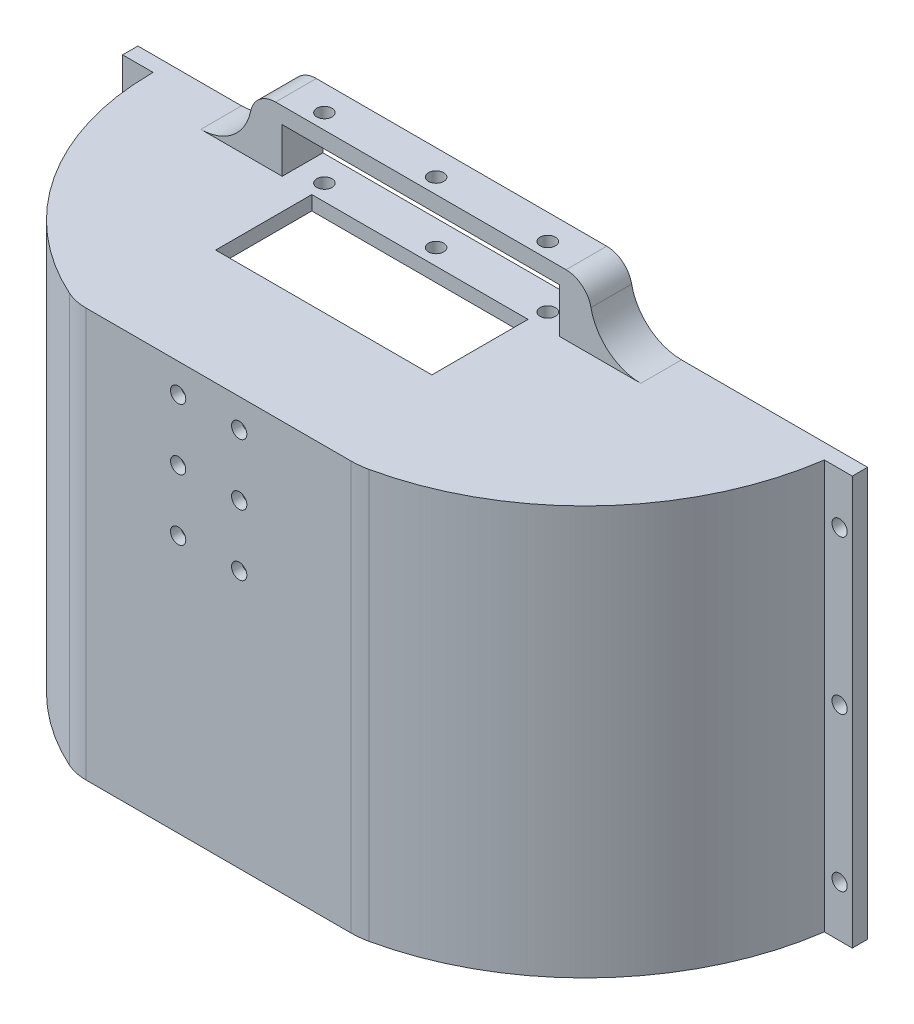
from build123d import *

# Parameters (mm, degrees)
SKETCH_1_W                  = 143.42529591
SKETCH_1_H                  = 80.35
SKETCH_1_R                  = 1.5
SKETCH_1_W_2                = 127.420983087
SKETCH_1_H_2                = 74.55
EXTRUDE_1_DEPTH             = 3
SKETCH_2_W                  = 131.42529591
SKETCH_2_H                  = 5
SKETCH_2_R                  = 1.5
EXTRUDE_2_DEPTH             = 2.8
SKETCH_3_R                  = 1.5
CUT_EXTRUDE_1_DEPTH         = 10
SKETCH_4_W                  = 6
SKETCH_4_H                  = 8
EXTRUDE_3_DEPTH             = 10
SKETCH_5_W                  = 54.485918212
SKETCH_5_H                  = 8
EXTRUDE_4_DEPTH             = 1.2
FILLET_1_R                  = 10
SKETCH_6_R                  = 1.5
CUT_EXTRUDE_2_DEPTH         = 3
EXTRUDE_5_DEPTH             = 2.8
SKETCH_8_W                  = 42.5
SKETCH_8_H                  = 8
SKETCH_8_H_2                = 10.9
SKETCH_8_R                  = 1.5
CUT_EXTRUDE_3_DEPTH         = 3
EXTRUDE_6_REACH             = 127.55
EXTRUDE_6_DIRECTION_2_DEPTH = 2.8
SKETCH_11_R                 = 1.5
SKETCH_11_R_2               = 1.490339558
CUT_EXTRUDE_4_DEPTH         = 3
EXTRUDE_START               = -3
EXTRUDE_7_DEPTH             = 3
EXTRUDE_START_2             = 2
SKETCH_13_W                 = 66.485918212
SKETCH_13_H                 = 8
SKETCH_13_R                 = 1.5
EXTRUDE_8_DEPTH             = 2
FILLET_2_R                  = 5


with BuildPart() as part:
    # 草图1 → 凸台-拉伸1 (new body)
    with BuildSketch(Plane.XY):
        with Locations((-13.602517363, 6.11984421)):
            Rectangle(SKETCH_1_W, SKETCH_1_H)
        with Locations((55.610130592, -24.05515579)):
            Circle(SKETCH_1_R, mode=Mode.SUBTRACT)
        with Locations((55.610130592, 6.11984421)):
            Circle(SKETCH_1_R, mode=Mode.SUBTRACT)
        with Locations((55.610130592, 36.29484421)):
            Circle(SKETCH_1_R, mode=Mode.SUBTRACT)
        with Locations((-82.810852495, -24.05515579)):
            Circle(SKETCH_1_R, mode=Mode.SUBTRACT)
        with Locations((-82.810852495, 6.11984421)):
            Circle(SKETCH_1_R, mode=Mode.SUBTRACT)
        with Locations((-82.810852495, 36.29484421)):
            Circle(SKETCH_1_R, mode=Mode.SUBTRACT)
        with Locations((-13.600360952, 6.21984421)):
            Rectangle(SKETCH_1_W_2, SKETCH_1_H_2, mode=Mode.SUBTRACT)
    extrude(amount=EXTRUDE_1_DEPTH)

    # 草图2 → 凸台-拉伸2 (add)
    with BuildSketch(Plane(origin=(0, 46.29484421, 0), x_dir=(1, 0, 0), z_dir=(0, 1, 0))):
        with Locations((-13.602517363, -5.5)):
            Rectangle(SKETCH_2_W, SKETCH_2_H)
        with Locations(Location((-21.702517363, -5, 0), (0, 0, 180))):
            Circle(SKETCH_2_R, mode=Mode.SUBTRACT)
    extrude(amount=-EXTRUDE_2_DEPTH)

    # 草图3 → 切除-拉伸1 (cut)
    with BuildSketch(Plane(origin=(0, 46.29484421, 0), x_dir=(1, 0, 0), z_dir=(0, 1, 0))):
        with Locations(Location((0.240439338, -5, 0), (0, 0, 270))):
            Circle(SKETCH_3_R)
        with Locations(Location((-43.645478874, -5, 0), (0, 0, 270))):
            Circle(SKETCH_3_R)
    extrude(amount=-CUT_EXTRUDE_1_DEPTH, mode=Mode.SUBTRACT)

    # 草图4 → 凸台-拉伸3 (add)
    with BuildSketch(Plane(origin=(0, 46.29484421, 0), x_dir=(1, 0, 0), z_dir=(0, 1, 0))):
        with Locations((8.540439338, -4)):
            Rectangle(SKETCH_4_W, SKETCH_4_H)
        with Locations((-51.945478874, -4)):
            Rectangle(SKETCH_4_W, SKETCH_4_H)
    extrude(amount=EXTRUDE_3_DEPTH)

    # 草图5 → 凸台-拉伸4 (add)
    with BuildSketch(Plane(origin=(0, 56.29484421, 0), x_dir=(1, 0, 0), z_dir=(0, 1, 0))):
        with Locations((-21.702519768, -4)):
            Rectangle(SKETCH_5_W, SKETCH_5_H)
    extrude(amount=-EXTRUDE_4_DEPTH)

    # 圆角1
    fillet_1_edges = [part.edges().sort_by_distance(p)[0] for p in [
        (11.540439338, 46.29484421, 4),
        (-54.945478874, 46.29484421, 4),
    ]]
    fillet(fillet_1_edges, radius=FILLET_1_R - 0.0001)  # a hair under: the kernel refuses the full size

    # 草图6 → 切除-拉伸2 (cut)
    with BuildSketch(Plane(origin=(0, 56.29484421, 0), x_dir=(1, 0, 0), z_dir=(0, 1, 0))):
        with Locations(Location((0.240439338, -5, 0), (0, 0, 270))):
            Circle(SKETCH_6_R)
        with Locations(Location((-21.702517363, -5, 0), (0, 0, 180))):
            Circle(SKETCH_6_R)
        with Locations(Location((-43.645478874, -5, 0), (0, 0, 270))):
            Circle(SKETCH_6_R)
    extrude(amount=-CUT_EXTRUDE_2_DEPTH, mode=Mode.SUBTRACT)

    # 草图7 → 凸台-拉伸5 (add)
    with BuildSketch(Plane(origin=(0, 46.29484421, 0), x_dir=(1, 0, 0), z_dir=(0, 1, 0))):
        with BuildLine():
            Line((52.110130592, -3), (-79.315165318, -3))
            ThreePointArc((-79.315165318, -3), (-71.408587337, -30.249323597), (-49.947485102, -48.808976146))
            ThreePointArc((-49.947485102, -48.808976146), (-47.931875984, -49.474706171), (-45.821160639, -49.7))
            Line((-45.821160639, -49.7), (3.801028521, -49.7))
            ThreePointArc((3.801028521, -49.7), (4.482979053, -49.676720076), (5.161754433, -49.606988694))
            ThreePointArc((5.161754433, -49.606988694), (36.42646247, -34.151078405), (52.110130592, -3))
        make_face()
    extrude(amount=-EXTRUDE_5_DEPTH)

    # 草图8 → 切除-拉伸3 (cut)
    with BuildSketch(Plane(origin=(0, 46.29484421, 0), x_dir=(1, 0, 0), z_dir=(0, 1, 0))):
        with BuildLine():
            Line((52.110130592, -8), (52.110130592, -3))
            ThreePointArc((52.110130592, -3), (51.686965751, -5.511139637), (51.148017839, -8))
            Line((51.148017839, -8), (52.110130592, -8))
        make_face()
        with BuildLine():
            ThreePointArc((-79.091069545, -8), (-79.253197971, -5.766605102), (-79.315165318, -3.528190833))
            Line((-79.315165318, -3.528190833), (-79.315165318, -8))
            Line((-79.315165318, -8), (-79.091069545, -8))
        make_face()
        with BuildLine():
            Line((-79.315165318, -3.528190833), (-79.315165318, -3))
            ThreePointArc((-79.315165318, -3), (-79.315862787, -3.264095416), (-79.315165318, -3.528190833))
        make_face()
        with Locations((-21.687503936, -23.091321672)):
            Rectangle(SKETCH_8_W, SKETCH_8_H)
        with Locations((-21.687503936, -13.641321672)):
            Rectangle(SKETCH_8_W, SKETCH_8_H_2)
        with Locations(Location((0.240439338, -5, 0), (0, 0, 270))):
            Circle(SKETCH_8_R)
        with Locations(Location((-43.645478874, -5, 0), (0, 0, 270))):
            Circle(SKETCH_8_R)
        with Locations(Location((-21.702517363, -5, 0), (0, 0, 270))):
            Circle(SKETCH_8_R)
    extrude(amount=-CUT_EXTRUDE_3_DEPTH, mode=Mode.SUBTRACT)

    # 凸台-拉伸6: up to this face of the body (flat: up to its plane)
    extrude_6_end = Plane(part.part.faces().sort_by_distance((-13.602517363, -34.05515579, 1.5))[0])
    # 草图9 → 凸台-拉伸6 (add, up to the picked face)
    with BuildSketch(Plane.XZ.offset(-43.49484421), mode=Mode.PRIVATE) as extrude_6_sk1:
        with BuildLine():
            ThreePointArc((-45.821160639, 49.7), (-47.931875984, 49.474706171), (-49.947485102, 48.808976146))
            ThreePointArc((-49.947485102, 48.808976146), (-71.265466668, 30.471277082), (-79.315165318, 3.528190833))
            Line((-79.315165318, 3.528190833), (-79.315165318, 3))
            Line((-79.315165318, 3), (-77.284463301, 3))
            Line((-77.284463301, 3), (-77.284463301, 5))
            ThreePointArc((-77.284463301, 5), (-69.179280492, 30.001857642), (-49.122220209, 46.987180917))
            ThreePointArc((-49.122220209, 46.987180917), (-47.509732915, 47.519764937), (-45.821160639, 47.7))
            Line((-45.821160639, 47.7), (3.801028521, 47.7))
            ThreePointArc((3.801028521, 47.7), (4.346588947, 47.681376061), (4.889609251, 47.625590956))
            ThreePointArc((4.889609251, 47.625590956), (34.185844829, 33.539377025), (49.748453895, 5))
            Line((49.748453895, 5), (50.110130592, 3))
            Line((50.110130592, 3), (52.615296987, 3))
            ThreePointArc((52.615296987, 3), (38.28835989, 32.947499211), (9.430945753, 49.359795972))
            ThreePointArc((9.430945753, 49.359795972), (7.851760578, 49.614706494), (6.254409581, 49.7))
            Line((6.254409581, 49.7), (-45.821160639, 49.7))
        make_face()
    extrude_6_tool1 = split(extrude(extrude_6_sk1.sketch, amount=EXTRUDE_6_REACH, mode=Mode.PRIVATE), bisect_by=extrude_6_end, keep=Keep.BOTH, mode=Mode.PRIVATE)
    add(extrude_6_tool1.solids().sort_by(Axis((-47.636477, 43.494844, 48.106717), (0, -1, 0)))[0])

    # 草图9 → 凸台-拉伸6 direction 2 (add)
    with BuildSketch(Plane.XZ.offset(-43.49484421)):
        with BuildLine():
            ThreePointArc((-45.821160639, 49.7), (-47.931875984, 49.474706171), (-49.947485102, 48.808976146))
            ThreePointArc((-49.947485102, 48.808976146), (-71.265466668, 30.471277082), (-79.315165318, 3.528190833))
            Line((-79.315165318, 3.528190833), (-79.315165318, 3))
            Line((-79.315165318, 3), (-77.284463301, 3))
            Line((-77.284463301, 3), (-77.284463301, 5))
            ThreePointArc((-77.284463301, 5), (-69.179280492, 30.001857642), (-49.122220209, 46.987180917))
            ThreePointArc((-49.122220209, 46.987180917), (-47.509732915, 47.519764937), (-45.821160639, 47.7))
            Line((-45.821160639, 47.7), (3.801028521, 47.7))
            ThreePointArc((3.801028521, 47.7), (4.346588947, 47.681376061), (4.889609251, 47.625590956))
            ThreePointArc((4.889609251, 47.625590956), (34.185844829, 33.539377025), (49.748453895, 5))
            Line((49.748453895, 5), (50.110130592, 3))
            Line((50.110130592, 3), (52.615296987, 3))
            ThreePointArc((52.615296987, 3), (38.28835989, 32.947499211), (9.430945753, 49.359795972))
            ThreePointArc((9.430945753, 49.359795972), (7.851760578, 49.614706494), (6.254409581, 49.7))
            Line((6.254409581, 49.7), (-45.821160639, 49.7))
        make_face()
    extrude(amount=-EXTRUDE_6_DIRECTION_2_DEPTH)

    # 草图11 → 切除-拉伸4 (cut)
    with BuildSketch(Plane(origin=(0, 0, 47.7), x_dir=(-1, 0, 0), z_dir=(0, 0, -1))):
        with Locations((15.702514958, 40.59484421)):
            Circle(SKETCH_11_R)
        with Locations((27.702514958, 40.59484421)):
            Circle(SKETCH_11_R)
        with Locations((15.702514958, 28.59484421)):
            Circle(SKETCH_11_R)
        with Locations((27.702514958, 28.59484421)):
            Circle(SKETCH_11_R_2)
        with Locations((27.702514958, 16.59484421)):
            Circle(SKETCH_11_R)
        with Locations((15.702514958, 16.59484421)):
            Circle(SKETCH_11_R)
    extrude(amount=-CUT_EXTRUDE_4_DEPTH, mode=Mode.SUBTRACT)

    # 草图12 → 凸台-拉伸7 (add)
    with BuildSketch(Plane.XZ.offset(34.05515579).offset(EXTRUDE_START)):
        with BuildLine():
            Line((50.110130592, 3), (-77.284463301, 3))
            Line((-77.284463301, 3), (-77.284463301, 5))
            ThreePointArc((-77.284463301, 5), (-69.179280492, 30.001857642), (-49.122220209, 46.987180917))
            ThreePointArc((-49.122220209, 46.987180917), (-47.509732915, 47.519764937), (-45.821160639, 47.7))
            Line((-45.821160639, 47.7), (3.801028521, 47.7))
            ThreePointArc((3.801028521, 47.7), (4.346588947, 47.681376061), (4.889609251, 47.625590956))
            ThreePointArc((4.889609251, 47.625590956), (34.185844829, 33.539377025), (49.748453895, 5))
            Line((49.748453895, 5), (50.110130592, 3))
        make_face()
        with BuildLine():
            Line((50.110130592, 3), (52.110130592, 3))
            Line((52.110130592, 3), (52.615296987, 3))
            ThreePointArc((52.615296987, 3), (38.28835989, 32.947499211), (9.430945753, 49.359795972))
            ThreePointArc((9.430945753, 49.359795972), (7.851760578, 49.614706494), (6.254409581, 49.7))
            Line((6.254409581, 49.7), (3.801028521, 49.7))
            Line((3.801028521, 49.7), (-45.821160639, 49.7))
            ThreePointArc((-45.821160639, 49.7), (-47.931875984, 49.474706171), (-49.947485102, 48.808976146))
            ThreePointArc((-49.947485102, 48.808976146), (-71.265466668, 30.471277082), (-79.315165318, 3.528190833))
            Line((-79.315165318, 3.528190833), (-79.315165318, 3))
            Line((-79.315165318, 3), (-77.284463301, 3))
            Line((-77.284463301, 3), (-77.284463301, 5))
            ThreePointArc((-77.284463301, 5), (-69.179280492, 30.001857642), (-49.122220209, 46.987180917))
            ThreePointArc((-49.122220209, 46.987180917), (-47.509732915, 47.519764937), (-45.821160639, 47.7))
            Line((-45.821160639, 47.7), (3.801028521, 47.7))
            ThreePointArc((3.801028521, 47.7), (4.346588947, 47.681376061), (4.889609251, 47.625590956))
            ThreePointArc((4.889609251, 47.625590956), (34.185844829, 33.539377025), (49.748453895, 5))
            Line((49.748453895, 5), (50.110130592, 3))
        make_face()
    extrude(amount=EXTRUDE_7_DEPTH)

    # 草图13 → 凸台-拉伸8 (add)
    with BuildSketch(Plane(origin=(0, 56.29484421, 0), x_dir=(1, 0, 0), z_dir=(0, 1, 0)).offset(EXTRUDE_START_2)):
        with Locations((-21.702519768, -4)):
            Rectangle(SKETCH_13_W, SKETCH_13_H)
        with Locations(Location((-43.645478874, -5, 0), (0, 0, 270))):
            Circle(SKETCH_13_R, mode=Mode.SUBTRACT)
        with Locations(Location((-21.702517363, -5, 0), (0, 0, 270))):
            Circle(SKETCH_13_R, mode=Mode.SUBTRACT)
        with Locations(Location((0.240439338, -5, 0), (0, 0, 270))):
            Circle(SKETCH_13_R, mode=Mode.SUBTRACT)
    extrude(amount=-EXTRUDE_8_DEPTH)

    # 圆角2
    fillet_2_edges = [part.edges().sort_by_distance(p)[0] for p in [
        (-54.945478874, 58.29484421, 4),
        (11.540439338, 58.29484421, 4),
    ]]
    fillet(fillet_2_edges, radius=FILLET_2_R)


solid = part.part
